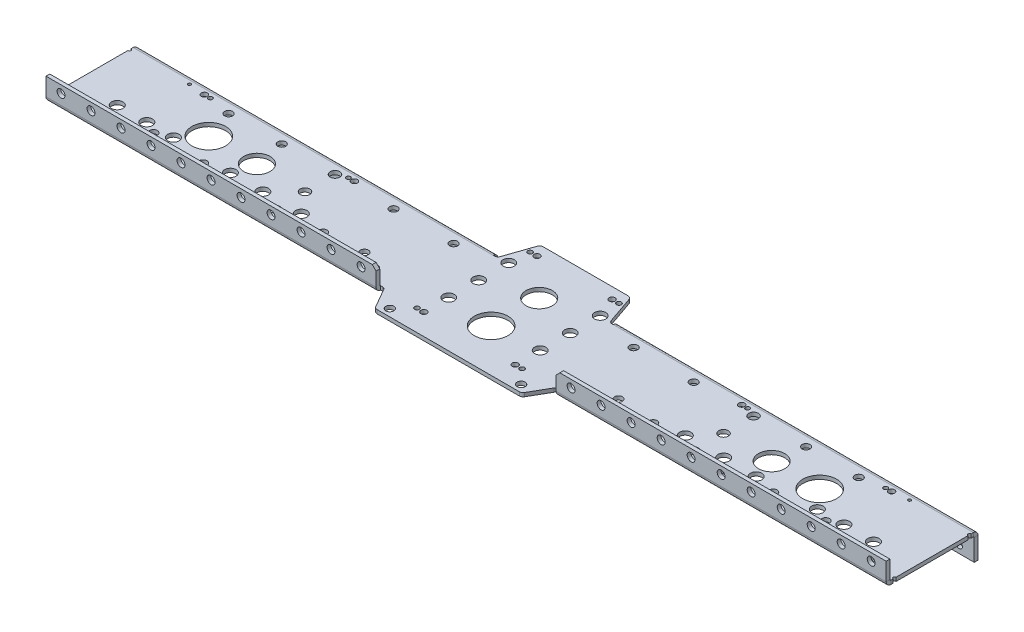
from build123d import *

# Parameters (mm, degrees)
SKETCH1_W                              = 812.8
SKETCH1_H                              = 69.85
BOSS_EXTRUDE1_DEPTH                    = 3.175
SKETCH3_R                              = 14.2875
CUT_EXTRUDE1_DEPTH                     = 816.802024467
EDGE_FLANGE1_DEPTH                     = 812.8
EDGE_FLANGE2_DEPTH                     = 812.8
SKETCH10_R                             = 4.826
LONG_6WD_DEPTH                         = 817.444922817
SKETCH11_R                             = 4.826
SHORT_6WD_DEPTH                        = 817.444922817
SKETCH12_R                             = 3.3528
F_8WD_EGG_DEPTH                        = 817.444922817
SKETCH13_R                             = 3.3528
LOWER_CHURRO_DEPTH                     = 817.444922817
SKETCH14_R                             = 2.667
UPPER_FLANGE_HP_DEPTH                  = 817.729920277
SKETCH16_R                             = 3.3528
LOWER_FLANGE_HP_DEPTH                  = 817.433889486
LPATTERN1_COUNT                        = 32
LPATTERN1_PITCH                        = 25.4
SKETCH17_W                             = 152.4
SKETCH17_H                             = 6.35
CUT_EXTRUDE9_DEPTH                     = 818.031193633
SKETCH18_W                             = 146.05
SKETCH18_H                             = 3.175
BOSS_EXTRUDE2_DEPTH                    = 19.05
SKETCH19_W                             = 101.6
SKETCH19_H                             = 3.937
CUT_EXTRUDE10_DEPTH                    = 818.031193633
SKETCH20_W                             = 95.25
SKETCH20_H                             = 3.175
BOSS_EXTRUDE3_DEPTH                    = 27.432
CUT_EXTRUDE14_DEPTH                    = 819.902667079
SKETCH21_R                             = 11.1125
SKETCH21_R_2                           = 4.7625
SKETCH21_R_3                           = 2.54
SKETCH21_R_4                           = 2.032
TB_MINI_SHAFT_PLATE_DEPTH              = 819.8226487
CUT_EXTRUDE12_DEPTH                    = 819.8226487
SKETCH23_R                             = 3.3528
UPPER_INTERNAL_CHIRRO_HP_DEPTH         = 819.8226487
SKETCH24_R                             = 1.27
CUTTING_GUIDES_DEPTH                   = 819.8226487
SKETCH26_R                             = 3.4036
SONIC_MOUNTING_HOLES_DEPTH             = 819.902667079
SKETCH29_R                             = 2.5527
SKETCH29_R_2                           = 1.7859375
SKETCH29_R_3                           = 14.2875
SKETCH29_R_4                           = 11.1125
SKETCH29_R_5                           = 4.064
TB_MICRO_MOUNTING_DEPTH                = 819.902667079
FILLET1_R                              = 3.175
CHAMFER1_SIZE                          = 3.175
SKETCH30_R                             = 3.3528
BOTTOM_CORNER_SUPPORT_USE_CHURRO_DEPTH = 819.902667079
SKETCH32_R                             = 3.3528
CUT_EXTRUDE15_DEPTH                    = 819.902667079
SKETCH33_R                             = 3.3528
CUT_EXTRUDE16_DEPTH                    = 819.902667079
CUT_EXTRUDE17_DEPTH                    = 819.902667079
CUT_EXTRUDE17_DEPTH_BACK               = 819.902667079


# Sheet-metal steps are written as plain solids
with BuildPart() as part:
    # Sketch1 → Boss-Extrude1 (new body)
    with BuildSketch(Plane(origin=(0, 0, 0), x_dir=(1, 0, 0), z_dir=(0, 1, 0))):
        with Locations((406.4, 34.925)):
            Rectangle(SKETCH1_W, SKETCH1_H)
    extrude(amount=BOSS_EXTRUDE1_DEPTH)

    # Sketch3 → Cut-Extrude1 (cut, through all)
    with BuildSketch(Plane(origin=(0, 3.175, 0), x_dir=(1, 0, 0), z_dir=(0, 1, 0))):
        with Locations(Location((406.4, 17.272, 0), (0, 0, 270))):
            Circle(SKETCH3_R)
    extrude(amount=-CUT_EXTRUDE1_DEPTH, mode=Mode.SUBTRACT)

    # Edge-Flange1 section (across the edge) → Edge-Flange1 (add)
    with BuildSketch(Plane(origin=(0, 3.175, 0.762), x_dir=(0, 0, -1), z_dir=(1, 0, 0))):
        with BuildLine():
            Line((-3.175, 0.762), (-3.175, 15.875))
            Line((-3.175, 15.875), (0, 15.875))
            Line((0, 15.875), (0, 0.762))
            ThreePointArc((0, 0.762), (0.223184633, 0.223184633), (0.762, 0))
            Line((0.762, 0), (0.762, -3.175))
            ThreePointArc((0.762, -3.175), (-2.021879398, -2.021879398), (-3.175, 0.762))
        make_face()
    extrude(amount=EDGE_FLANGE1_DEPTH)

    # Edge-Flange2 section (across the edge) → Edge-Flange2 (add)
    with BuildSketch(Plane(origin=(0, 0, -70.612), x_dir=(0, 0, 1), z_dir=(1, 0, 0))):
        with BuildLine():
            Line((-3.175, 0.762), (-3.175, 19.05))
            Line((-3.175, 19.05), (0, 19.05))
            Line((0, 19.05), (0, 0.762))
            ThreePointArc((0, 0.762), (0.223184633, 0.223184633), (0.762, 0))
            Line((0.762, 0), (0.762, -3.175))
            ThreePointArc((0.762, -3.175), (-2.021879398, -2.021879398), (-3.175, 0.762))
        make_face()
    extrude(amount=EDGE_FLANGE2_DEPTH)

    # Sketch10 → Long 6wd (cut, through all)
    with BuildSketch(Plane(origin=(0, 3.175, 0), x_dir=(1, 0, 0), z_dir=(0, 1, 0))):
        with Locations(Location((86.339113657, 20.828, 0), (0, 0, 270))):
            Circle(SKETCH10_R)
        with Locations(Location((111.349627997, 20.828, 0), (0, 0, 270))):
            Circle(SKETCH10_R)
        with Locations(Location((133.855797334, 20.828, 0), (0, 0, 270))):
            Circle(SKETCH10_R)
        with Locations(Location((726.460886343, 20.828, 0), (0, 0, 270))):
            Circle(SKETCH10_R)
        with Locations(Location((701.450372003, 20.828, 0), (0, 0, 270))):
            Circle(SKETCH10_R)
        with Locations(Location((678.944202666, 20.828, 0), (0, 0, 270))):
            Circle(SKETCH10_R)
    extrude(amount=-LONG_6WD_DEPTH, mode=Mode.SUBTRACT)

    # Sketch11 → Short 6wd (cut, through all)
    with BuildSketch(Plane(origin=(0, 3.175, 0), x_dir=(1, 0, 0), z_dir=(0, 1, 0))):
        with Locations(Location((183.852302373, 19.05, 0), (0, 0, 270))):
            Circle(SKETCH11_R)
        with Locations(Location((211.361504088, 19.05, 0), (0, 0, 270))):
            Circle(SKETCH11_R)
        with Locations(Location((243.875125248, 19.05, 0), (0, 0, 270))):
            Circle(SKETCH11_R)
        with Locations(Location((568.924874752, 19.05, 0), (0, 0, 270))):
            Circle(SKETCH11_R)
        with Locations(Location((601.438495912, 19.05, 0), (0, 0, 270))):
            Circle(SKETCH11_R)
        with Locations(Location((628.947697627, 19.05, 0), (0, 0, 270))):
            Circle(SKETCH11_R)
    extrude(amount=-SHORT_6WD_DEPTH, mode=Mode.SUBTRACT)

    # Sketch12 → 8wd egg (cut, through all)
    with BuildSketch(Plane(origin=(0, 3.175, 0), x_dir=(1, 0, 0), z_dir=(0, 1, 0))):
        with Locations(Location((298.874532383, 17.547282407, 0), (0, 0, 270))):
            Circle(SKETCH12_R)
        with Locations(Location((513.925467617, 17.547282407, 0), (0, 0, 270))):
            Circle(SKETCH12_R)
    extrude(amount=-F_8WD_EGG_DEPTH, mode=Mode.SUBTRACT)

    # Sketch13 → lower churro (cut, through all)
    with BuildSketch(Plane(origin=(0, 3.175, 0), x_dir=(1, 0, 0), z_dir=(0, 1, 0))):
        with Locations(Location((165.1, 14.732, 0), (0, 0, 270))):
            Circle(SKETCH13_R)
        with Locations(Location((266.7, 14.732, 0), (0, 0, 270))):
            Circle(SKETCH13_R)
        with Locations(Location((546.1, 14.732, 0), (0, 0, 270))):
            Circle(SKETCH13_R)
        with Locations(Location((647.7, 14.732, 0), (0, 0, 270))):
            Circle(SKETCH13_R)
    extrude(amount=-LOWER_CHURRO_DEPTH, mode=Mode.SUBTRACT)

    # Sketch14 → upper flange HP (cut, through all)
    with BuildSketch(Plane(origin=(0, 0, -73.787), x_dir=(-1, 0, 0), z_dir=(0, 0, -1))):
        with Locations(Location((-12.7, -12.7, 0), (0, 0, 90))):
            Circle(SKETCH14_R)
        with Locations(Location((-38.1, -12.7, 0), (0, 0, 90))):
            Circle(SKETCH14_R)
        with Locations(Location((-63.5, -12.7, 0), (0, 0, 90))):
            Circle(SKETCH14_R)
        with Locations(Location((-88.9, -12.7, 0), (0, 0, 90))):
            Circle(SKETCH14_R)
        with Locations(Location((-114.3, -12.7, 0), (0, 0, 90))):
            Circle(SKETCH14_R)
        with Locations(Location((-139.7, -12.7, 0), (0, 0, 90))):
            Circle(SKETCH14_R)
        with Locations(Location((-165.1, -12.7, 0), (0, 0, 90))):
            Circle(SKETCH14_R)
        with Locations(Location((-190.5, -12.7, 0), (0, 0, 90))):
            Circle(SKETCH14_R)
        with Locations(Location((-215.9, -12.7, 0), (0, 0, 90))):
            Circle(SKETCH14_R)
        with Locations(Location((-241.3, -12.7, 0), (0, 0, 90))):
            Circle(SKETCH14_R)
        with Locations(Location((-266.7, -12.7, 0), (0, 0, 90))):
            Circle(SKETCH14_R)
        with Locations(Location((-292.1, -12.7, 0), (0, 0, 90))):
            Circle(SKETCH14_R)
        with Locations(Location((-317.5, -12.7, 0), (0, 0, 90))):
            Circle(SKETCH14_R)
        with Locations(Location((-342.9, -12.7, 0), (0, 0, 90))):
            Circle(SKETCH14_R)
        with Locations(Location((-368.3, -12.7, 0), (0, 0, 90))):
            Circle(SKETCH14_R)
        with Locations(Location((-393.7, -12.7, 0), (0, 0, 90))):
            Circle(SKETCH14_R)
        with Locations(Location((-419.1, -12.7, 0), (0, 0, 90))):
            Circle(SKETCH14_R)
        with Locations(Location((-444.5, -12.7, 0), (0, 0, 90))):
            Circle(SKETCH14_R)
        with Locations(Location((-469.9, -12.7, 0), (0, 0, 90))):
            Circle(SKETCH14_R)
        with Locations(Location((-495.3, -12.7, 0), (0, 0, 90))):
            Circle(SKETCH14_R)
        with Locations(Location((-520.7, -12.7, 0), (0, 0, 90))):
            Circle(SKETCH14_R)
        with Locations(Location((-546.1, -12.7, 0), (0, 0, 90))):
            Circle(SKETCH14_R)
        with Locations(Location((-571.5, -12.7, 0), (0, 0, 90))):
            Circle(SKETCH14_R)
        with Locations(Location((-596.9, -12.7, 0), (0, 0, 90))):
            Circle(SKETCH14_R)
        with Locations(Location((-622.3, -12.7, 0), (0, 0, 90))):
            Circle(SKETCH14_R)
        with Locations(Location((-647.7, -12.7, 0), (0, 0, 90))):
            Circle(SKETCH14_R)
        with Locations(Location((-673.1, -12.7, 0), (0, 0, 90))):
            Circle(SKETCH14_R)
        with Locations(Location((-698.5, -12.7, 0), (0, 0, 90))):
            Circle(SKETCH14_R)
        with Locations(Location((-723.9, -12.7, 0), (0, 0, 90))):
            Circle(SKETCH14_R)
        with Locations(Location((-749.3, -12.7, 0), (0, 0, 90))):
            Circle(SKETCH14_R)
        with Locations(Location((-774.7, -12.7, 0), (0, 0, 90))):
            Circle(SKETCH14_R)
        with Locations(Location((-800.1, -12.7, 0), (0, 0, 90))):
            Circle(SKETCH14_R)
    extrude(amount=-UPPER_FLANGE_HP_DEPTH, mode=Mode.SUBTRACT)

    # Sketch16 → Lower flange HP (cut, through all)
    with BuildSketch(Plane(origin=(0, 0, 0.762), x_dir=(-1, 0, 0), z_dir=(0, 0, -1))):
        with Locations(Location((-12.7, 12.7, 0), (0, 0, 90))):
            Circle(SKETCH16_R)
    lower_flange_hp = extrude(amount=-LOWER_FLANGE_HP_DEPTH, mode=Mode.SUBTRACT)

    # LPattern1: Lower flange HP ×32
    with Locations(*[(i * LPATTERN1_PITCH, 0, 0) for i in range(1, LPATTERN1_COUNT)]):
        add(lower_flange_hp, mode=Mode.SUBTRACT)

    # Sketch17 → Cut-Extrude9 (cut, through all)
    with BuildSketch(Plane(origin=(0, 19.05, 0), x_dir=(1, 0, 0), z_dir=(0, 1, 0))):
        with Locations((406.4, -3.175)):
            Rectangle(SKETCH17_W, SKETCH17_H)
    extrude(amount=-CUT_EXTRUDE9_DEPTH, mode=Mode.SUBTRACT)

    # Sketch18 → Boss-Extrude2 (add)
    with BuildSketch(Plane.XY):
        with Locations((406.4, 1.5875)):
            Rectangle(SKETCH18_W, SKETCH18_H)
    extrude(amount=BOSS_EXTRUDE2_DEPTH)

    # Sketch19 → Cut-Extrude10 (cut, through all)
    with BuildSketch(Plane.XZ.offset(19.05)):
        with Locations((406.4, -71.8185)):
            Rectangle(SKETCH19_W, SKETCH19_H)
    extrude(amount=-CUT_EXTRUDE10_DEPTH, mode=Mode.SUBTRACT)

    # Sketch20 → Boss-Extrude3 (add)
    with BuildSketch(Plane(origin=(0, 0, -69.85), x_dir=(-1, 0, 0), z_dir=(0, 0, -1))):
        with Locations((-406.4, 1.5875)):
            Rectangle(SKETCH20_W, SKETCH20_H)
    extrude(amount=BOSS_EXTRUDE3_DEPTH)

    # Sketch27 → Cut-Extrude14 (cut, through all)
    with BuildSketch(Plane(origin=(0, 3.175, 0), x_dir=(1, 0, 0), z_dir=(0, 1, 0))):
        Polygon((333.375, 0), (344.373522628, -19.05), (333.375, -19.05), align=None)
        Polygon((479.425, 0), (479.425, -19.05), (468.426477372, -19.05), align=None)
    extrude(amount=-CUT_EXTRUDE14_DEPTH, mode=Mode.SUBTRACT)

    # Sketch21 → TB Mini Shaft plate (cut, through all)
    with BuildSketch(Plane.XZ):
        with Locations(Location((406.4, -57.9628, 0), (0, 0, 270))):
            Circle(SKETCH21_R)
        with Locations(Location((445.12429721, -45.466, 0), (0, 0, 270))):
            Circle(SKETCH21_R_2)
        with Locations(Location((367.67570279, -45.466, 0), (0, 0, 270))):
            Circle(SKETCH21_R_2)
        with Locations(Location((445.12429721, -70.866, 0), (0, 0, 270))):
            Circle(SKETCH21_R_2)
        with Locations(Location((445.12429721, -20.066, 0), (0, 0, 270))):
            Circle(SKETCH21_R_2)
        with Locations(Location((367.67570279, -20.066, 0), (0, 0, 270))):
            Circle(SKETCH21_R_2)
        with Locations(Location((367.67570279, -70.866, 0), (0, 0, 270))):
            Circle(SKETCH21_R_2)
        with Locations(Location((438.15, -87.85352, 0), (0, 0, 270))):
            Circle(SKETCH21_R_3)
        with Locations(Location((374.65, -87.85352, 0), (0, 0, 270))):
            Circle(SKETCH21_R_3)
        with Locations(Location((443.992, -87.85352, 0), (0, 0, 270))):
            Circle(SKETCH21_R_4)
        with Locations(Location((368.808, -87.85352, 0), (0, 0, 270))):
            Circle(SKETCH21_R_4)
        with Locations(Location((445.0461, 1.03886, 0), (0, 0, 270))):
            Circle(SKETCH21_R_3)
        with Locations(Location((367.7539, 1.03886, 0), (0, 0, 270))):
            Circle(SKETCH21_R_3)
        with Locations(Location((361.9119, 1.03886, 0), (0, 0, 270))):
            Circle(SKETCH21_R_4)
        with Locations(Location((450.8881, 1.03886, 0), (0, 0, 270))):
            Circle(SKETCH21_R_4)
    extrude(amount=-TB_MINI_SHAFT_PLATE_DEPTH, mode=Mode.SUBTRACT)

    # Sketch22 → Cut-Extrude12 (cut, through all)
    with BuildSketch(Plane.XZ):
        Polygon((454.025, -69.85), (444.579404912, -97.282), (454.025, -97.282), align=None)
        Polygon((358.775, -69.85), (368.220595088, -97.282), (358.775, -97.282), align=None)
    extrude(amount=-CUT_EXTRUDE12_DEPTH, mode=Mode.SUBTRACT)

    # Sketch23 → Upper internal chirro HP (cut, through all)
    with BuildSketch(Plane.XZ):
        with Locations(Location((330.2, -61.722, 0), (0, 0, 270))):
            Circle(SKETCH23_R)
        with Locations(Location((279.4, -61.722, 0), (0, 0, 270))):
            Circle(SKETCH23_R)
        with Locations(Location((139.7, -61.722, 0), (0, 0, 270))):
            Circle(SKETCH23_R)
        with Locations(Location((25.4, -61.722, 0), (0, 0, 270))):
            Circle(SKETCH23_R)
        with Locations(Location((482.6, -61.722, 0), (0, 0, 270))):
            Circle(SKETCH23_R)
        with Locations(Location((533.4, -61.722, 0), (0, 0, 270))):
            Circle(SKETCH23_R)
        with Locations(Location((673.1, -61.722, 0), (0, 0, 270))):
            Circle(SKETCH23_R)
        with Locations(Location((787.4, -61.722, 0), (0, 0, 270))):
            Circle(SKETCH23_R)
        with Locations(Location((6.35, -39.497, 0), (0, 0, 270))):
            Circle(SKETCH23_R)
        with Locations(Location((806.45, -39.497, 0), (0, 0, 270))):
            Circle(SKETCH23_R)
    extrude(amount=-UPPER_INTERNAL_CHIRRO_HP_DEPTH, mode=Mode.SUBTRACT)

    # Sketch24 → Cutting guides (cut, through all)
    with BuildSketch(Plane.XZ):
        with Locations(Location((101.6, -3.175, 0), (0, 0, 270))):
            Circle(SKETCH24_R)
        with Locations(Location((101.6, -66.675, 0), (0, 0, 270))):
            Circle(SKETCH24_R)
        with Locations(Location((50.8, -66.675, 0), (0, 0, 270))):
            Circle(SKETCH24_R)
        with Locations(Location((50.8, -3.175, 0), (0, 0, 270))):
            Circle(SKETCH24_R)
        with Locations(Location((762, -66.675, 0), (0, 0, 270))):
            Circle(SKETCH24_R)
        with Locations(Location((762, -3.175, 0), (0, 0, 270))):
            Circle(SKETCH24_R)
        with Locations(Location((711.2, -3.175, 0), (0, 0, 270))):
            Circle(SKETCH24_R)
        with Locations(Location((711.2, -66.675, 0), (0, 0, 270))):
            Circle(SKETCH24_R)
    extrude(amount=-CUTTING_GUIDES_DEPTH, mode=Mode.SUBTRACT)

    # Sketch26 → Sonic mounting holes (cut, through all)
    with BuildSketch(Plane(origin=(0, 3.175, 0), x_dir=(1, 0, 0), z_dir=(0, 1, 0))):
        with Locations(Location((350.8375, -12.8905, 0), (0, 0, 270))):
            Circle(SKETCH26_R)
        with Locations(Location((461.9625, -12.8905, 0), (0, 0, 270))):
            Circle(SKETCH26_R)
    extrude(amount=-SONIC_MOUNTING_HOLES_DEPTH, mode=Mode.SUBTRACT)

    # Sketch29 → TB Micro Mounting (cut, through all)
    with BuildSketch(Plane(origin=(0, 3.175, 0), x_dir=(1, 0, 0), z_dir=(0, 1, 0))):
        with Locations(Location((115.520362832, 65.405, 0), (0, 0, 270))):
            Circle(SKETCH29_R)
        with Locations(Location((120.600362832, 65.405, 0), (0, 0, 270))):
            Circle(SKETCH29_R_2)
        with Locations(Location((147.829162832, 36.83, 0), (0, 0, 270))):
            Circle(SKETCH29_R_3)
        with Locations(Location((115.520362832, 8.255, 0), (0, 0, 270))):
            Circle(SKETCH29_R)
        with Locations(Location((120.600362832, 8.255, 0), (0, 0, 270))):
            Circle(SKETCH29_R_2)
        with Locations(Location((188.545362832, 36.83, 0), (0, 0, 270))):
            Circle(SKETCH29_R_4)
        with Locations(Location((229.261562832, 36.83, 0), (0, 0, 270))):
            Circle(SKETCH29_R_5)
        with Locations(Location((229.261562832, 62.23, 0), (0, 0, 270))):
            Circle(SKETCH29_R_5)
        with Locations(Location((229.261562832, 11.43, 0), (0, 0, 270))):
            Circle(SKETCH29_R_5)
        with Locations(Location((237.440362832, 8.255, 0), (0, 0, 270))):
            Circle(SKETCH29_R_2)
        with Locations(Location((242.520362832, 8.255, 0), (0, 0, 270))):
            Circle(SKETCH29_R)
        with Locations(Location((237.440362832, 65.405, 0), (0, 0, 270))):
            Circle(SKETCH29_R_2)
        with Locations(Location((242.520362832, 65.405, 0), (0, 0, 270))):
            Circle(SKETCH29_R)
        with Locations(Location((570.279637168, 65.405, 0), (0, 0, 270))):
            Circle(SKETCH29_R)
        with Locations(Location((575.359637168, 65.405, 0), (0, 0, 270))):
            Circle(SKETCH29_R_2)
        with Locations(Location((583.538437168, 62.23, 0), (0, 0, 270))):
            Circle(SKETCH29_R_5)
        with Locations(Location((583.538437168, 36.83, 0), (0, 0, 270))):
            Circle(SKETCH29_R_5)
        with Locations(Location((624.254637168, 36.83, 0), (0, 0, 270))):
            Circle(SKETCH29_R_4)
        with Locations(Location((570.279637168, 8.255, 0), (0, 0, 270))):
            Circle(SKETCH29_R)
        with Locations(Location((575.359637168, 8.255, 0), (0, 0, 270))):
            Circle(SKETCH29_R_2)
        with Locations(Location((583.538437168, 11.43, 0), (0, 0, 270))):
            Circle(SKETCH29_R_5)
        with Locations(Location((664.970837168, 36.83, 0), (0, 0, 270))):
            Circle(SKETCH29_R_3)
        with Locations(Location((692.199637168, 65.405, 0), (0, 0, 270))):
            Circle(SKETCH29_R_2)
        with Locations(Location((697.279637168, 65.405, 0), (0, 0, 270))):
            Circle(SKETCH29_R)
        with Locations(Location((692.199637168, 8.255, 0), (0, 0, 270))):
            Circle(SKETCH29_R_2)
        with Locations(Location((697.279637168, 8.255, 0), (0, 0, 270))):
            Circle(SKETCH29_R)
    extrude(amount=-TB_MICRO_MOUNTING_DEPTH, mode=Mode.SUBTRACT)

    # Fillet1
    fillet1_edges = [part.edges().sort_by_distance(p)[0] for p in [
        (333.375, 1.5875, 0),
        (479.425, 1.5875, 0),
        (454.025, 1.5875, -69.85),
        (358.775, 1.5875, -69.85),
        (468.426477372, 1.5875, 19.05),
        (344.373522628, 1.5875, 19.05),
        (368.220595088, 1.5875, -97.282),
        (444.579404912, 1.5875, -97.282),
    ]]
    fillet(fillet1_edges, radius=FILLET1_R)

    # Chamfer1
    chamfer1_edges = [part.edges().sort_by_distance(p)[0] for p in [
        (0, 19.05, 2.3495),
        (812.8, 19.05, 2.3495),
        (482.6, 19.05, 2.3495),
        (330.2, 19.05, 2.3495),
        (0, -19.05, -72.1995),
        (812.8, -19.05, -72.1995),
        (355.6, -19.05, -72.1995),
        (457.2, -19.05, -72.1995),
    ]]
    chamfer(chamfer1_edges, length=CHAMFER1_SIZE)

    # Sketch30 → Bottom Corner Support (use churro) (cut, through all)
    with BuildSketch(Plane(origin=(0, 3.175, 0), x_dir=(1, 0, 0), z_dir=(0, 1, 0))):
        with Locations(Location((72.898, 9.525, 0), (0, 0, 270))):
            Circle(SKETCH30_R)
        with Locations(Location((121.92, 15.875, 0), (0, 0, 270))):
            Circle(SKETCH30_R)
        with Locations(Location((739.902, 9.525, 0), (0, 0, 90))):
            Circle(SKETCH30_R)
        with Locations(Location((690.88, 15.875, 0), (0, 0, 90))):
            Circle(SKETCH30_R)
    extrude(amount=-BOTTOM_CORNER_SUPPORT_USE_CHURRO_DEPTH, mode=Mode.SUBTRACT)

    # Sketch32 → Cut-Extrude15 (cut, through all)
    with BuildSketch(Plane(origin=(0, 3.175, 0), x_dir=(1, 0, 0), z_dir=(0, 1, 0))):
        with Locations(Location((184.480781416, 61.976, 0), (0, 0, 270))):
            Circle(SKETCH32_R)
        with Locations(Location((628.319218584, 61.976, 0), (0, 0, 90))):
            Circle(SKETCH32_R)
    extrude(amount=-CUT_EXTRUDE15_DEPTH, mode=Mode.SUBTRACT)

    # Sketch33 → Cut-Extrude16 (cut, through all)
    with BuildSketch(Plane(origin=(0, 3.175, 0), x_dir=(1, 0, 0), z_dir=(0, 1, 0))):
        with Locations(Location((200.025, 10.287, 0), (0, 0, 270))):
            Circle(SKETCH33_R)
        with Locations(Location((314.325, 10.287, 0), (0, 0, 270))):
            Circle(SKETCH33_R)
        with Locations(Location((498.475, 10.287, 0), (0, 0, 90))):
            Circle(SKETCH33_R)
        with Locations(Location((612.775, 10.287, 0), (0, 0, 90))):
            Circle(SKETCH33_R)
    extrude(amount=-CUT_EXTRUDE16_DEPTH, mode=Mode.SUBTRACT)

    # Sketch34 → Cut-Extrude17 (cut, two sides: drawn at the far end of the back side and taken through both)
    with BuildSketch(Plane(origin=(0, 3.175, 0), x_dir=(1, 0, 0), z_dir=(0, 1, 0)).offset(-CUT_EXTRUDE17_DEPTH_BACK)):
        Polygon((50.8, 66.675), (50.8, 3.175), (50.8, -3.937), (0, -3.937), (0, 73.787), (50.8, 73.787), align=None)
        Polygon((762, 66.675), (762, 4.445), (762, -3.937), (812.8, -3.937), (812.8, 73.787), (762, 73.787), align=None)
    extrude(amount=CUT_EXTRUDE17_DEPTH + CUT_EXTRUDE17_DEPTH_BACK, mode=Mode.SUBTRACT)


solid = part.part
